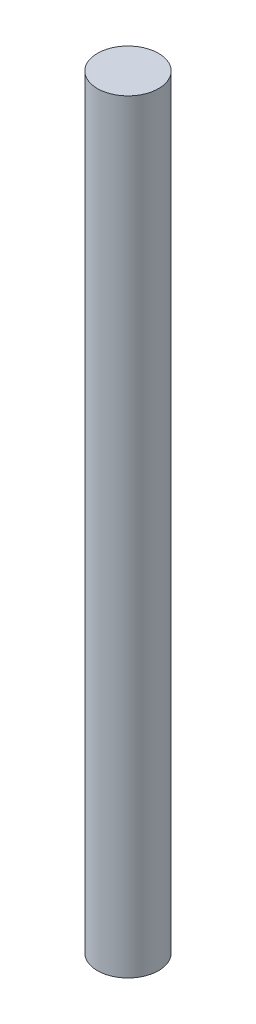
from build123d import *

# Parameters (mm, degrees)
SKETCH1_R           = 0.5
BOSS_EXTRUDE1_DEPTH = 12.5
SCALE1_SCALE        = 6


with BuildPart() as part:
    # Sketch1 → Boss-Extrude1 (new body)
    with BuildSketch(Plane(origin=(0, 0, 0), x_dir=(1, 0, 0), z_dir=(0, 1, 0))):
        Circle(SKETCH1_R)
    extrude(amount=BOSS_EXTRUDE1_DEPTH)


with BuildPart() as part_1:
    # Scale1: scaled about (0, 6.25, 0)
    add(part.part.scale(SCALE1_SCALE).moved(Location((0, -31.25, 0))))


solid = part_1.part
